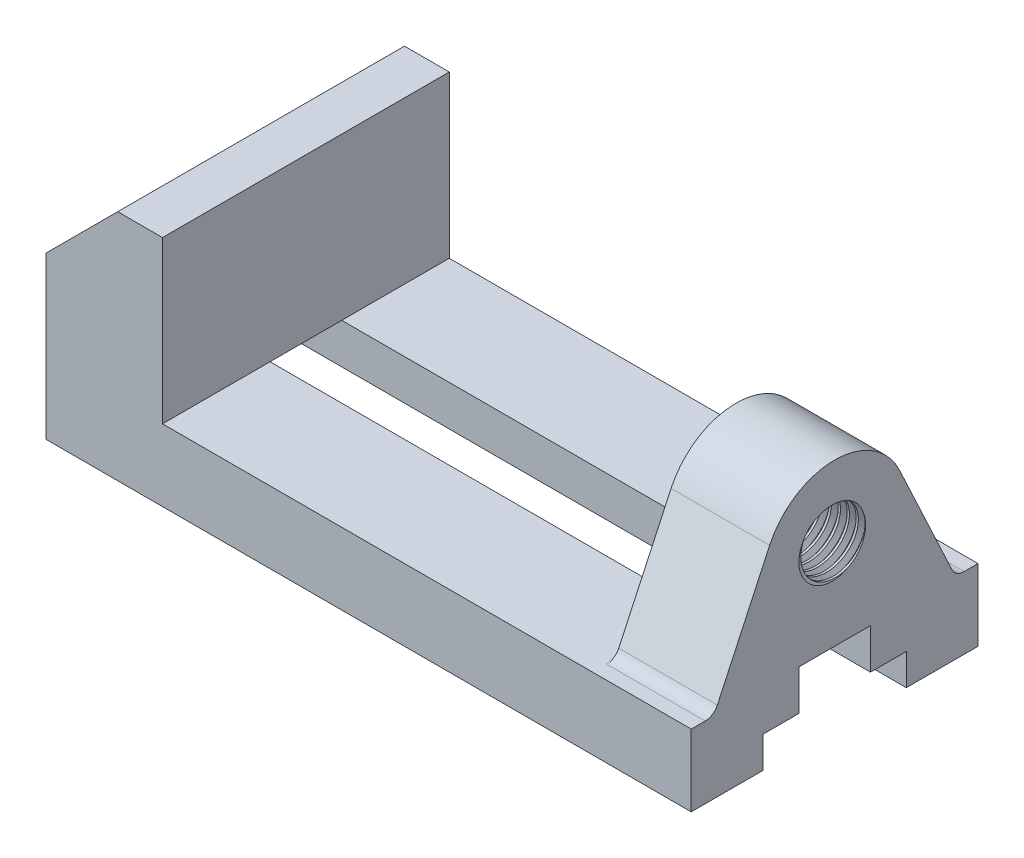
from build123d import *

# Parameters (mm, degrees)
SKETCH1_W                       = 144
SKETCH1_H                       = 64
BOSS_EXTRUDE1_DEPTH             = 52
CUT_EXTRUDE1_DEPTH              = 157.409718368
CUT_EXTRUDE2_DEPTH              = 118
SKETCH3_5_R                     = 8
CUT_EXTRUDE3_DEPTH              = 30
CUT_EXTRUDE4_DEPTH              = 95.40338977
CUT_EXTRUDE4_DEPTH_BACK         = 95.40338977
SKETCH5_W                       = 96
SKETCH5_H                       = 36
CUT_EXTRUDE5_DEPTH              = 110.471457467
CUT_EXTRUDE5_DEPTH_BACK         = 110.471457467
M6X1_0_TAPPED_HOLE1_D           = 6
M6X1_0_TAPPED_HOLE1_DEPTH       = 10
M6X1_0_TAPPED_HOLE1_CSINK_D     = 6.05
M6X1_0_TAPPED_HOLE1_CSINK_ANGLE = 90
M6X1_0_TAPPED_HOLE1_TIP         = 1.732050808
THREAD2_PITCH                   = 2
THREAD2_FROM                    = 10
THREAD2_TO                      = 32


with BuildPart() as part:
    # Sketch1 → Boss-Extrude1 (new body)
    with BuildSketch(Plane(origin=(0, 0, 0), x_dir=(1, 0, 0), z_dir=(0, 1, 0))):
        Rectangle(SKETCH1_W, SKETCH1_H)
    extrude(amount=BOSS_EXTRUDE1_DEPTH)

    # Sketch3 → Cut-Extrude1 (cut, through all)
    with BuildSketch(Plane(origin=(72, 0, 0), x_dir=(0, 0, -1), z_dir=(1, 0, 0))):
        Polygon((-16, 7), (-16, 0), (16, 0), (16, 7), (8, 7), (8, 16), (-8, 16), (-8, 7), align=None)
    extrude(amount=-CUT_EXTRUDE1_DEPTH, mode=Mode.SUBTRACT)

    # Sketch3<4> → Cut-Extrude2 (cut)
    with BuildSketch(Plane(origin=(72, 0, 0), x_dir=(0, 0, -1), z_dir=(1, 0, 0))):
        with BuildLine():
            ThreePointArc((-28.891410649, 16), (-27.279511824, 16.469825663), (-26.172487288, 17.732145215))
            Line((-26.172487288, 17.732145215), (-14.500924593, 42.761892188))
            ThreePointArc((-14.500924593, 42.761892188), (-8.596793734, 49.494263133), (0, 52))
            Line((0, 52), (-32, 52))
            Line((-32, 52), (-32, 16))
            Line((-32, 16), (-28.891410649, 16))
        make_face()
        with BuildLine():
            Line((32, 52), (0, 52))
            ThreePointArc((0, 52), (8.596793734, 49.494263133), (14.500924593, 42.761892188))
            Line((14.500924593, 42.761892188), (26.172487288, 17.732145215))
            ThreePointArc((26.172487288, 17.732145215), (27.279511824, 16.469825663), (28.891410649, 16))
            Line((28.891410649, 16), (32, 16))
            Line((32, 16), (32, 52))
        make_face()
    extrude(amount=-CUT_EXTRUDE2_DEPTH, mode=Mode.SUBTRACT)

    # Sketch3<5> → Cut-Extrude3 (cut)
    with BuildSketch(Plane(origin=(72, 0, 0), x_dir=(0, 0, -1), z_dir=(1, 0, 0))):
        with Locations((0, 36)):
            Circle(SKETCH3_5_R)
    extrude(amount=-CUT_EXTRUDE3_DEPTH, mode=Mode.SUBTRACT)

    # Sketch5 → Cut-Extrude4 (cut, two sides: drawn at the far end of the back side and taken through both)
    with BuildSketch(Plane.XY.offset(-CUT_EXTRUDE4_DEPTH_BACK)):
        with Locations((2, 34)):
            Rectangle(SKETCH5_W, SKETCH5_H)
    extrude(amount=CUT_EXTRUDE4_DEPTH + CUT_EXTRUDE4_DEPTH_BACK, mode=Mode.SUBTRACT)

    # Sketch6 → Cut-Extrude5 (cut, two sides: drawn at the far end of the back side and taken through both)
    with BuildSketch(Plane(origin=(0, 0, -32), x_dir=(-1, 0, 0), z_dir=(0, 0, -1)).offset(-CUT_EXTRUDE5_DEPTH_BACK)):
        Polygon((56, 52), (72, 36), (72, 52), align=None)
    extrude(amount=CUT_EXTRUDE5_DEPTH + CUT_EXTRUDE5_DEPTH_BACK, mode=Mode.SUBTRACT)

    # M6x1.0 Tapped Hole1
    with Locations(Plane(origin=(-34, 0, 22), x_dir=(0, 0, -1), z_dir=(0, -1, 0))):
        with Locations((0, 0), (0, 70), (44, 0), (44, 70)):
            CounterSinkHole(M6X1_0_TAPPED_HOLE1_D / 2, M6X1_0_TAPPED_HOLE1_CSINK_D / 2, depth=M6X1_0_TAPPED_HOLE1_DEPTH, counter_sink_angle=M6X1_0_TAPPED_HOLE1_CSINK_ANGLE)
            with Locations((0, 0, -(M6X1_0_TAPPED_HOLE1_DEPTH + M6X1_0_TAPPED_HOLE1_TIP / 2))):  # 120° drill point
                Cone(0, M6X1_0_TAPPED_HOLE1_D / 2, M6X1_0_TAPPED_HOLE1_TIP, mode=Mode.SUBTRACT)

    # Thread2: arcs per turn and ends read off the stored shape
    # Thread2: the profile of Thread Profile2 profile screwed along a right-hand helix through 20 turns, 10 arcs to a turn; built about Z, then put on its axis
    thread2_z = Axis((0, 0, 0), (0, 0, 1))
    thread2_corners = [(8.0003, 0, -0.000173205), (8.0003, 0, 1.7501732), (6.91746825, 0, 1.124999997), (6.91746825, 0, 0.624999997)]
    with BuildLine(mode=Mode.PRIVATE) as thread2_profile:
        Line(thread2_corners[0], thread2_corners[1])
        Line(thread2_corners[1], thread2_corners[2])
        Line(thread2_corners[2], thread2_corners[3])
        Line(thread2_corners[3], thread2_corners[0])
    thread2_cap = Face(thread2_profile.wire())
    thread2_turn_angles = [0, 18, 36, 54, 72, 90, 108, 126, 144, 162, 180, 198, 216, 234, 252, 270, 288, 306, 324, 342, 360]
    thread2_turn_weights = [1, 0.9510565162951535, 1, 0.9510565162951535, 1, 0.9510565162951535, 1, 0.9510565162951535, 1, 0.9510565162951535, 1, 0.9510565162951535, 1, 0.9510565162951535, 1, 0.9510565162951535, 1, 0.9510565162951535, 1, 0.9510565162951535, 1]
    thread2_turn_rails = [Edge.make_bspline([Vector(p[0], p[1], 0).rotate(thread2_z, thread2_turn_angles[k]) / thread2_turn_weights[k] + Vector(0, 0, p[2] + THREAD2_PITCH * thread2_turn_angles[k] / 360) for k in range(21)], [0, 0, 0, 1, 1, 2, 2, 3, 3, 4, 4, 5, 5, 6, 6, 7, 7, 8, 8, 9, 9, 10, 10, 10], 2, thread2_turn_weights) for p in thread2_corners]
    thread2_turn_sides = [Face.make_surface_from_curves(thread2_turn_rails[p[0]], thread2_turn_rails[p[1]]) for p in [(0, 1), (1, 2), (2, 3), (3, 0)]]
    thread2 = Plane(origin=(82, 36, 0), x_dir=(0, 0, 1), z_dir=(-1, 0, 0)) * split(split(Solid(Shell([*[p.moved(Location((0, 0, THREAD2_PITCH * i))) for i in range(20) for p in thread2_turn_sides], thread2_cap, thread2_cap.rotate(thread2_z, 7200).moved(Location((0, 0, THREAD2_PITCH * 7200 / 360)))])), bisect_by=Plane.XY.offset(THREAD2_FROM), keep=Keep.TOP, mode=Mode.PRIVATE), bisect_by=Plane.XY.offset(THREAD2_TO), keep=Keep.BOTTOM, mode=Mode.PRIVATE)
    add(thread2)


solid = part.part
